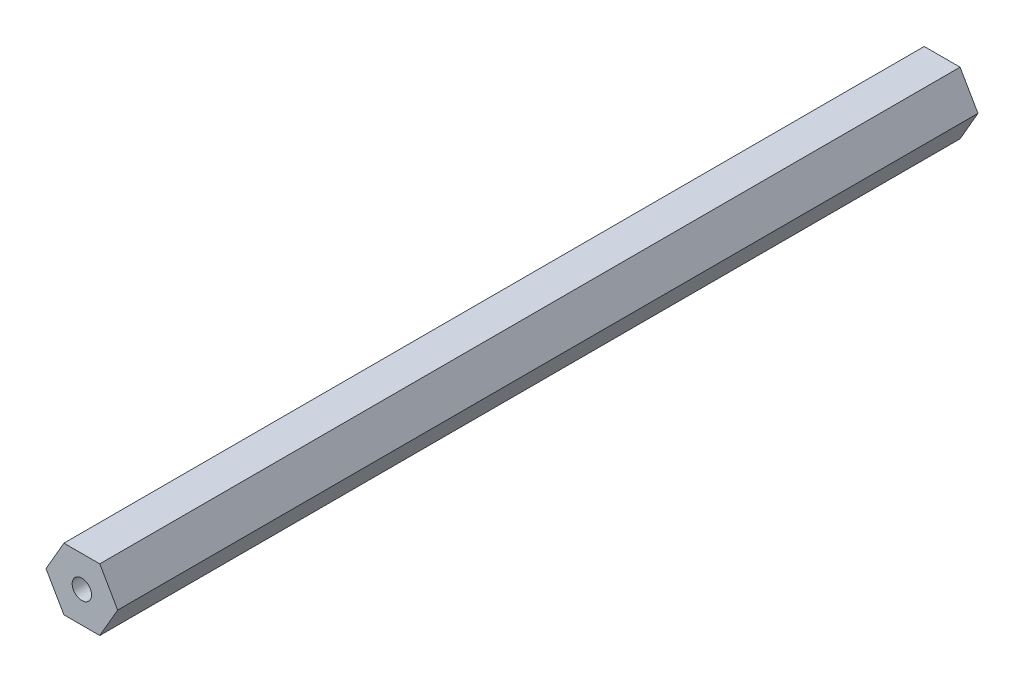
from build123d import *

# Parameters (mm, degrees)
SKETCH1_R           = 1.7145
BOSS_EXTRUDE1_DEPTH = 76.2


with BuildPart() as part:
    # Sketch1 → Boss-Extrude1 (new, symmetric)
    with BuildSketch(Plane.XY):
        Polygon((6.35, 0), (3.175, 5.499261314), (-3.175, 5.499261314), (-6.35, 0), (-3.175, -5.499261314), (3.175, -5.499261314), align=None)
        Circle(SKETCH1_R, mode=Mode.SUBTRACT)
    extrude(amount=BOSS_EXTRUDE1_DEPTH, both=True)


solid = part.part
